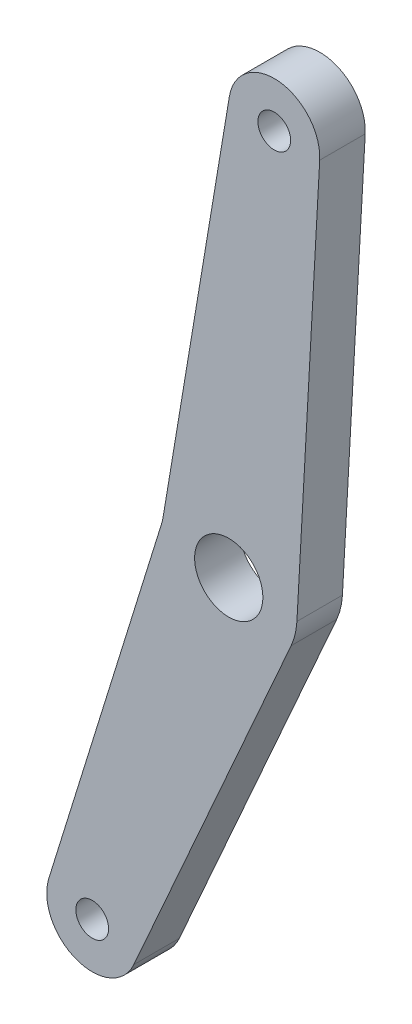
from build123d import *

# Parameters (mm, degrees)
SKETCH1_R           = 2.286
SKETCH1_R_2         = 4.7625
BOSS_EXTRUDE1_DEPTH = 6.35


with BuildPart() as part:
    # Sketch1 → Boss-Extrude1 (new body)
    with BuildSketch(Plane.XY):
        with BuildLine():
            Line((-6.064833834, 1.881565989), (9.681301524, 52.63593498))
            ThreePointArc((9.681301524, 52.63593498), (9.794859066, 53.051219958), (9.880015402, 53.473245226))
            Line((9.880015402, 53.473245226), (19.136452288, 108.994255743))
            ThreePointArc((19.136452288, 108.994255743), (26.099028192, 114.2614071), (31.74025321, 107.598305199))
            Line((31.74025321, 107.598305199), (28.560379815, 50.272457798))
            ThreePointArc((28.560379815, 50.272457798), (28.310154146, 48.569491046), (27.757531676, 46.939363121))
            Line((27.757531676, 46.939363121), (5.805021117, -2.573757919))
            ThreePointArc((5.805021117, -2.573757919), (-2.231446491, -5.945010224), (-6.064833834, 1.881565989))
        make_face()
        Circle(SKETCH1_R, mode=Mode.SUBTRACT)
        with Locations((25.4, 107.95)):
            Circle(SKETCH1_R, mode=Mode.SUBTRACT)
        with Locations((19.05, 50.8)):
            Circle(SKETCH1_R_2, mode=Mode.SUBTRACT)
    extrude(amount=BOSS_EXTRUDE1_DEPTH)


solid = part.part
